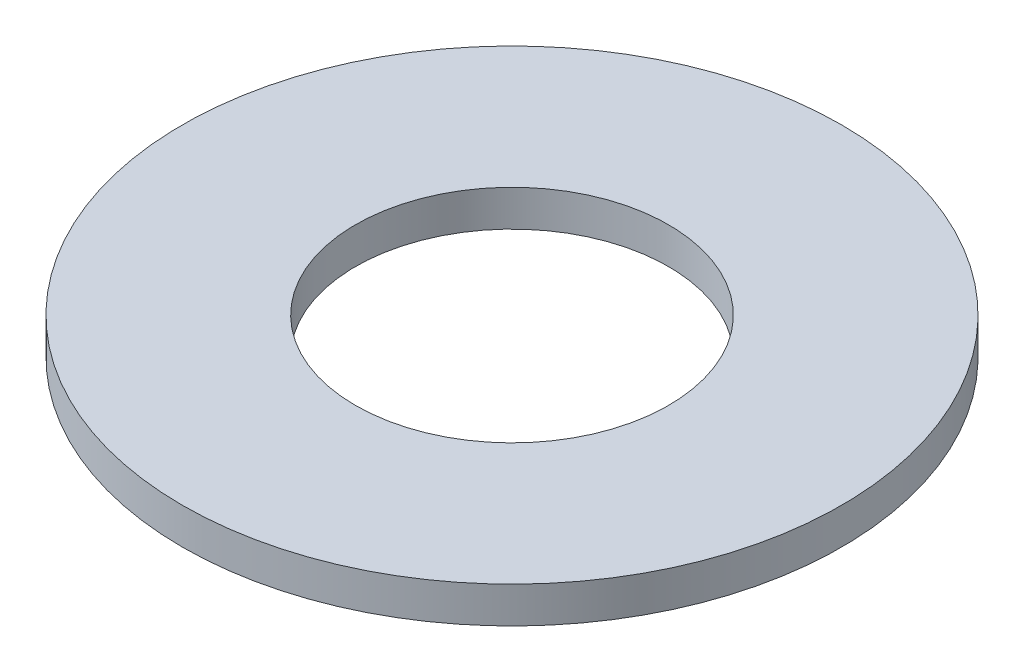
from build123d import *

# Parameters (mm, degrees)
SKETCH1_R           = 100
BOSS_EXTRUDE1_DEPTH = 11
SKETCH2_R           = 47.5
CUT_EXTRUDE1_DEPTH  = 142.848510743


with BuildPart() as part:
    # Sketch1 → Boss-Extrude1 (new body)
    with BuildSketch(Plane(origin=(0, 0, 0), x_dir=(1, 0, 0), z_dir=(0, 1, 0))):
        Circle(SKETCH1_R)
    extrude(amount=BOSS_EXTRUDE1_DEPTH)

    # Sketch2 → Cut-Extrude1 (cut, through all)
    with BuildSketch(Plane(origin=(0, 0, 0), x_dir=(1, 0, 0), z_dir=(0, 1, 0))):
        Circle(SKETCH2_R)
    extrude(amount=CUT_EXTRUDE1_DEPTH, mode=Mode.SUBTRACT)


solid = part.part
